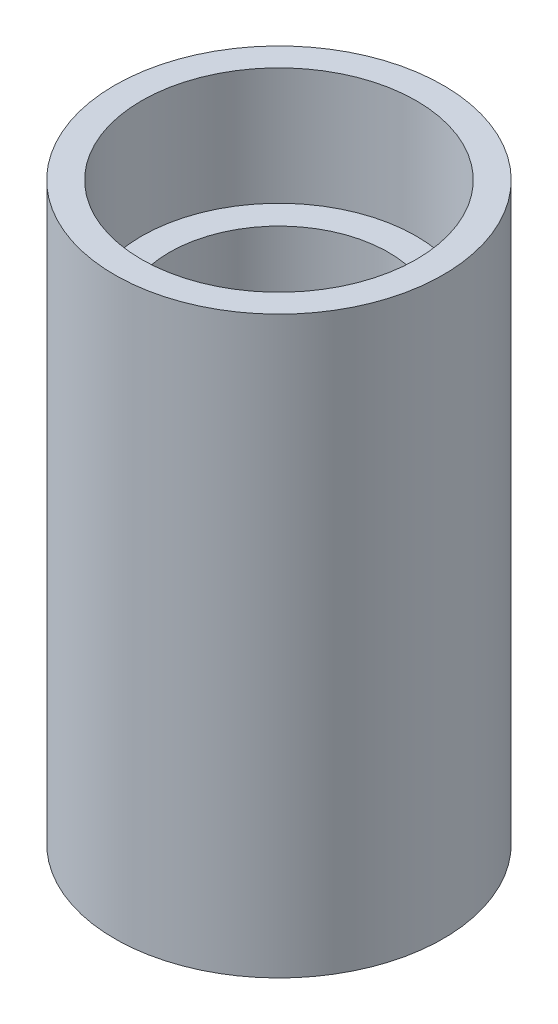
from build123d import *


with BuildPart() as part:
    # Sketch1 → Revolve1 (revolve)
    with BuildSketch(Plane.XY):
        Polygon((25.4, 0), (38.1, 0), (38.1, 133.35), (31.877, 133.35), (31.877, 106.1466), (25.4, 106.1466), align=None)
    revolve(axis=Axis((0, 55.746772516, 0), (0, -1, 0)))


solid = part.part
